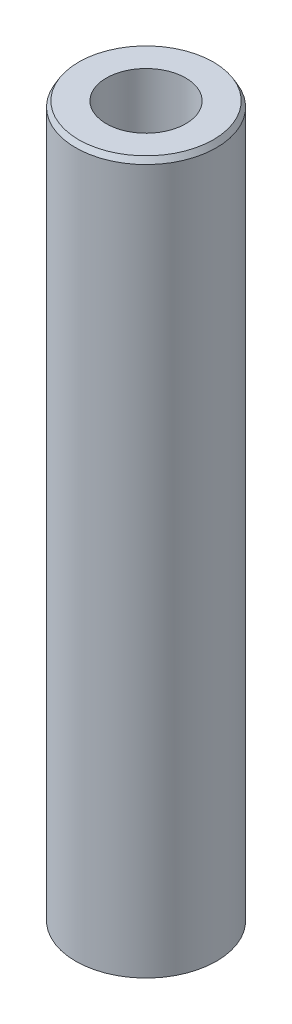
from build123d import *
from OCP.BRepFilletAPI import BRepFilletAPI_MakeChamfer

# Parameters (mm, degrees)
SKETCH1_R           = 35
BOSS_EXTRUDE1_DEPTH = 354.328485598
SKETCH2_R           = 19.723302546
CUT_EXTRUDE1_DEPTH  = 358.769025638
CHAMFER1_SIZE       = 2.674651307
CHAMFER1_SIZE2      = 1.544210652


with BuildPart() as part:
    # Sketch1 → Boss-Extrude1 (new body)
    with BuildSketch(Plane(origin=(0, 0, 0), x_dir=(1, 0, 0), z_dir=(0, 1, 0))):
        Circle(SKETCH1_R)
    extrude(amount=BOSS_EXTRUDE1_DEPTH)

    # Sketch2 → Cut-Extrude1 (cut, through all)
    with BuildSketch(Plane(origin=(0, 0, 0), x_dir=(1, 0, 0), z_dir=(0, 1, 0))):
        Circle(SKETCH2_R)
    extrude(amount=CUT_EXTRUDE1_DEPTH, mode=Mode.SUBTRACT)

    # Chamfer1: one chamfer whose edges measure the first distance from different faces: ONE call of the kernel's chamfer builder (chamfer() names one face for all edges)
    chamfer1_edges_1 = [part.edges().sort_by_distance(p)[0] for p in [
        (-35, 354.328485598, 0),
    ]]
    chamfer1_side_1 = [part.faces().sort_by_distance(p)[0] for p in [
        (-35, 177.164242799, 0),
    ]]
    chamfer1_edges_2 = [part.edges().sort_by_distance(p)[0] for p in [
        (-35, 0, 0),
    ]]
    chamfer1_side_2 = [part.faces().sort_by_distance(p)[0] for p in [
        (-34.010050506, 0, 0),
    ]]
    chamfer1 = BRepFilletAPI_MakeChamfer(part.part.solid().wrapped)
    for e in chamfer1_edges_1:
        chamfer1.Add(CHAMFER1_SIZE, CHAMFER1_SIZE2, e.wrapped, chamfer1_side_1[0].wrapped)  # the first distance lies on this face
    for e in chamfer1_edges_2:
        chamfer1.Add(CHAMFER1_SIZE, CHAMFER1_SIZE2, e.wrapped, chamfer1_side_2[0].wrapped)  # the first distance lies on this face
    add(Compound.cast(chamfer1.Shape()), mode=Mode.REPLACE)


solid = part.part
